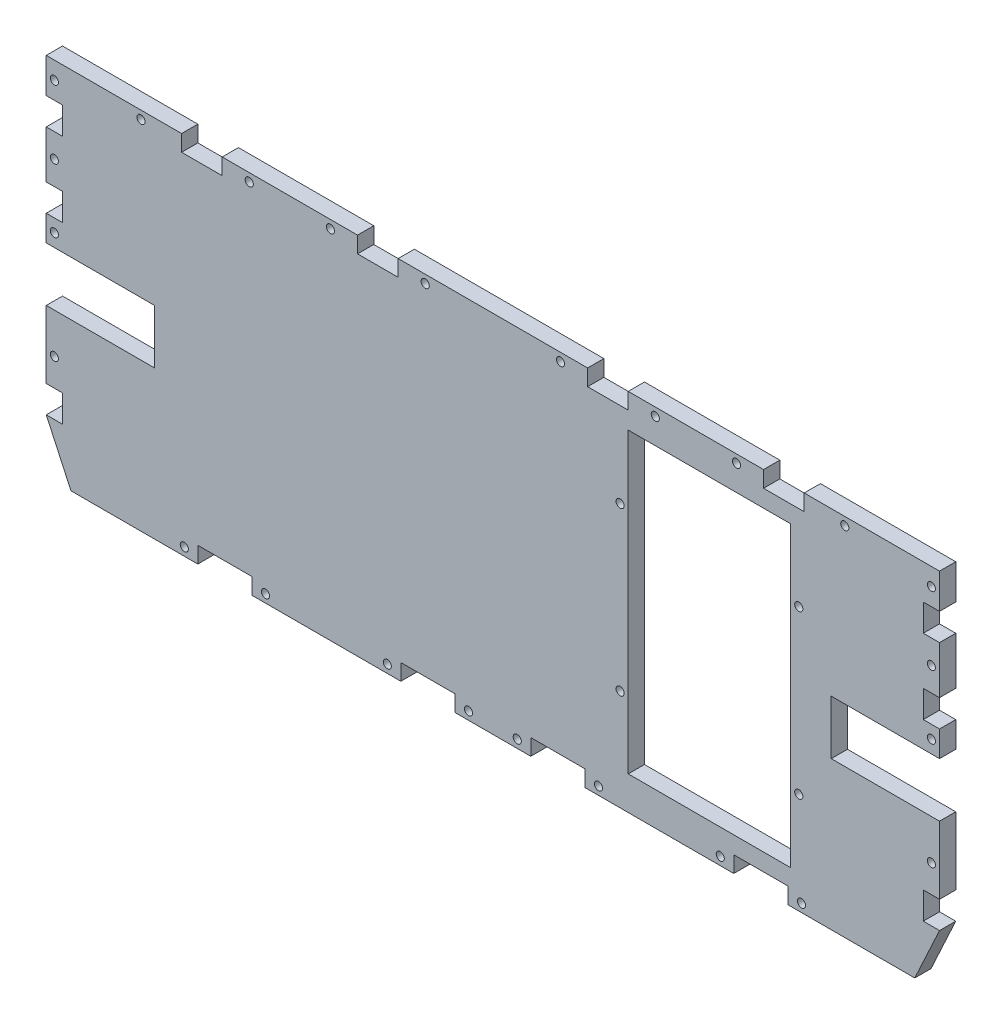
from build123d import *

# Parameters (mm, degrees)
BOSS_EXTRU_1_DEPTH      = 6
ESQUISSE3_W             = 6
ESQUISSE3_H             = 10
ESQUISSE3_W_2           = 20
ESQUISSE3_H_2           = 6
ESQUISSE3_W_3           = 60
ESQUISSE3_H_3           = 110
ESQUISSE3_W_4           = 15
ESQUISSE3_W_5           = 40
ESQUISSE3_H_4           = 20
ENL_V_MAT_EXTRU_2_DEPTH = 6
ESQUISSE4_R             = 1.5
ENL_V_MAT_EXTRU_3_DEPTH = 6
ESQUISSE5_W             = 456.045253014
ESQUISSE5_H             = 136.228984631
ENL_V_MAT_EXTRU_4_DEPTH = 6


with BuildPart() as part:
    # Esquisse1 → Boss.-Extru.1 (new body)
    with BuildSketch(Plane.XY):
        Polygon((-165, 96.73), (165, 96.73), (165, -18.27), (123, -109.022410436), (-123, -109.022410436), (-165, -18.27), align=None)
    extrude(amount=BOSS_EXTRU_1_DEPTH)

    # Esquisse3 → Enlèv. mat.-Extru.2 (cut)
    with BuildSketch(Plane(origin=(0, 0, 0), x_dir=(-1, 0, 0), z_dir=(0, 0, -1))):
        with Locations((162, -13.27)):
            Rectangle(ESQUISSE3_W, ESQUISSE3_H)
        with Locations((162, 78.852589564)):
            Rectangle(ESQUISSE3_W, ESQUISSE3_H)
        with Locations((-24, -35.02)):
            Rectangle(ESQUISSE3_W_2, ESQUISSE3_H_2)
        with Locations((99, -35.02)):
            Rectangle(ESQUISSE3_W_2, ESQUISSE3_H_2)
        with Locations((-162, 51.23)):
            Rectangle(ESQUISSE3_W, ESQUISSE3_H)
        with Locations((-80, 29.355)):
            Rectangle(ESQUISSE3_W_3, ESQUISSE3_H_3)
        with Locations((24, -35.02)):
            Rectangle(ESQUISSE3_W_2, ESQUISSE3_H_2)
        with Locations((-162, 78.852589564)):
            Rectangle(ESQUISSE3_W, ESQUISSE3_H)
        with Locations((-162, -13.27)):
            Rectangle(ESQUISSE3_W, ESQUISSE3_H)
        with Locations((107.5, 93.73)):
            Rectangle(ESQUISSE3_W_4, ESQUISSE3_H_2)
        with Locations((-42.5, 93.73)):
            Rectangle(ESQUISSE3_W_4, ESQUISSE3_H_2)
        with Locations((42.5, 93.73)):
            Rectangle(ESQUISSE3_W_4, ESQUISSE3_H_2)
        with Locations((-107.5, 93.73)):
            Rectangle(ESQUISSE3_W_4, ESQUISSE3_H_2)
        with Locations((162, 51.23)):
            Rectangle(ESQUISSE3_W, ESQUISSE3_H)
        with Locations((-99, -35.02)):
            Rectangle(ESQUISSE3_W_2, ESQUISSE3_H_2)
        with Locations((-145, 26.73)):
            Rectangle(ESQUISSE3_W_5, ESQUISSE3_H_4)
        with Locations((145, 26.73)):
            Rectangle(ESQUISSE3_W_5, ESQUISSE3_H_4)
    extrude(amount=-ENL_V_MAT_EXTRU_2_DEPTH, mode=Mode.SUBTRACT)

    # Esquisse4 → Enlèv. mat.-Extru.3 (cut)
    with BuildSketch(Plane(origin=(0, 0, 0), x_dir=(-1, 0, 0), z_dir=(0, 0, -1))):
        with Locations((162, 1.92)):
            Circle(ESQUISSE4_R)
        with Locations((114, -35.02)):
            Circle(ESQUISSE4_R)
        with Locations((162, 65.042589564)):
            Circle(ESQUISSE4_R)
        with Locations((84, -35.02)):
            Circle(ESQUISSE4_R)
        with Locations((39, -35.02)):
            Circle(ESQUISSE4_R)
        with Locations((162, 90.29)):
            Circle(ESQUISSE4_R)
        with Locations((9, -35.02)):
            Circle(ESQUISSE4_R)
        with Locations((-9, -35.02)):
            Circle(ESQUISSE4_R)
        with Locations((-39, -35.02)):
            Circle(ESQUISSE4_R)
        with Locations((-84, -35.02)):
            Circle(ESQUISSE4_R)
        with Locations((130, 93.73)):
            Circle(ESQUISSE4_R)
        with Locations((-114, -35.02)):
            Circle(ESQUISSE4_R)
        with Locations((90, 93.73)):
            Circle(ESQUISSE4_R)
        with Locations((-162, 41.48)):
            Circle(ESQUISSE4_R)
        with Locations((60, 93.73)):
            Circle(ESQUISSE4_R)
        with Locations((25, 93.73)):
            Circle(ESQUISSE4_R)
        with Locations((-113, 59.355)):
            Circle(ESQUISSE4_R)
        with Locations((-25, 93.73)):
            Circle(ESQUISSE4_R)
        with Locations((-60, 93.73)):
            Circle(ESQUISSE4_R)
        with Locations((-90, 93.73)):
            Circle(ESQUISSE4_R)
        with Locations((-130, 93.73)):
            Circle(ESQUISSE4_R)
        with Locations((-162, 90.29)):
            Circle(ESQUISSE4_R)
        with Locations((-162, 65.042589564)):
            Circle(ESQUISSE4_R)
        with Locations((-162, 1.92)):
            Circle(ESQUISSE4_R)
        with Locations((-113, -0.645)):
            Circle(ESQUISSE4_R)
        with Locations((-47, -0.645)):
            Circle(ESQUISSE4_R)
        with Locations((-47, 59.355)):
            Circle(ESQUISSE4_R)
        with Locations((162, 41.48)):
            Circle(ESQUISSE4_R)
    extrude(amount=-ENL_V_MAT_EXTRU_3_DEPTH, mode=Mode.SUBTRACT)

    # Esquisse5 → Enlèv. mat.-Extru.4 (cut)
    with BuildSketch(Plane(origin=(0, 0, 0), x_dir=(-1, 0, 0), z_dir=(0, 0, -1))):
        with Locations((-18.307092018, -106.134492316)):
            Rectangle(ESQUISSE5_W, ESQUISSE5_H)
    extrude(amount=-ENL_V_MAT_EXTRU_4_DEPTH, mode=Mode.SUBTRACT)


solid = part.part
